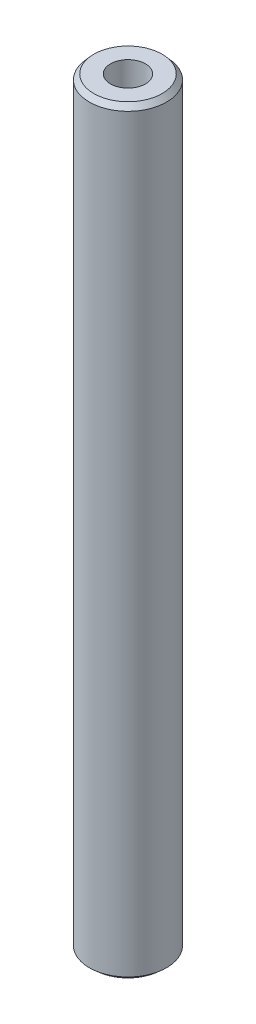
from build123d import *
from OCP.BRepFilletAPI import BRepFilletAPI_MakeChamfer

# Parameters (mm, degrees)
SKETCH1_R           = 5
BOSS_EXTRUDE1_DEPTH = 98.279254614
SKETCH2_R           = 2.261122947
CUT_EXTRUDE1_DEPTH  = 99.533303444
CHAMFER1_SIZE       = 0.663003901
CHAMFER1_SIZE2      = 0.580546898


with BuildPart() as part:
    # Sketch1 → Boss-Extrude1 (new body)
    with BuildSketch(Plane(origin=(0, 0, 0), x_dir=(1, 0, 0), z_dir=(0, 1, 0))):
        Circle(SKETCH1_R)
    extrude(amount=BOSS_EXTRUDE1_DEPTH)

    # Sketch2 → Cut-Extrude1 (cut, through all)
    with BuildSketch(Plane(origin=(0, 0, 0), x_dir=(1, 0, 0), z_dir=(0, 1, 0))):
        Circle(SKETCH2_R)
    extrude(amount=CUT_EXTRUDE1_DEPTH, mode=Mode.SUBTRACT)

    # Chamfer1: one chamfer whose edges measure the first distance from different faces: ONE call of the kernel's chamfer builder (chamfer() names one face for all edges)
    chamfer1_edges_1 = [part.edges().sort_by_distance(p)[0] for p in [
        (-5, 98.279254614, 0),
    ]]
    chamfer1_side_1 = [part.faces().sort_by_distance(p)[0] for p in [
        (-5, 49.139627307, 0),
    ]]
    chamfer1_edges_2 = [part.edges().sort_by_distance(p)[0] for p in [
        (-5, 0, 0),
    ]]
    chamfer1_side_2 = [part.faces().sort_by_distance(p)[0] for p in [
        (-4.858578644, 0, 0),
    ]]
    chamfer1 = BRepFilletAPI_MakeChamfer(part.part.solid().wrapped)
    for e in chamfer1_edges_1:
        chamfer1.Add(CHAMFER1_SIZE, CHAMFER1_SIZE2, e.wrapped, chamfer1_side_1[0].wrapped)  # the first distance lies on this face
    for e in chamfer1_edges_2:
        chamfer1.Add(CHAMFER1_SIZE, CHAMFER1_SIZE2, e.wrapped, chamfer1_side_2[0].wrapped)  # the first distance lies on this face
    add(Compound.cast(chamfer1.Shape()), mode=Mode.REPLACE)


solid = part.part
